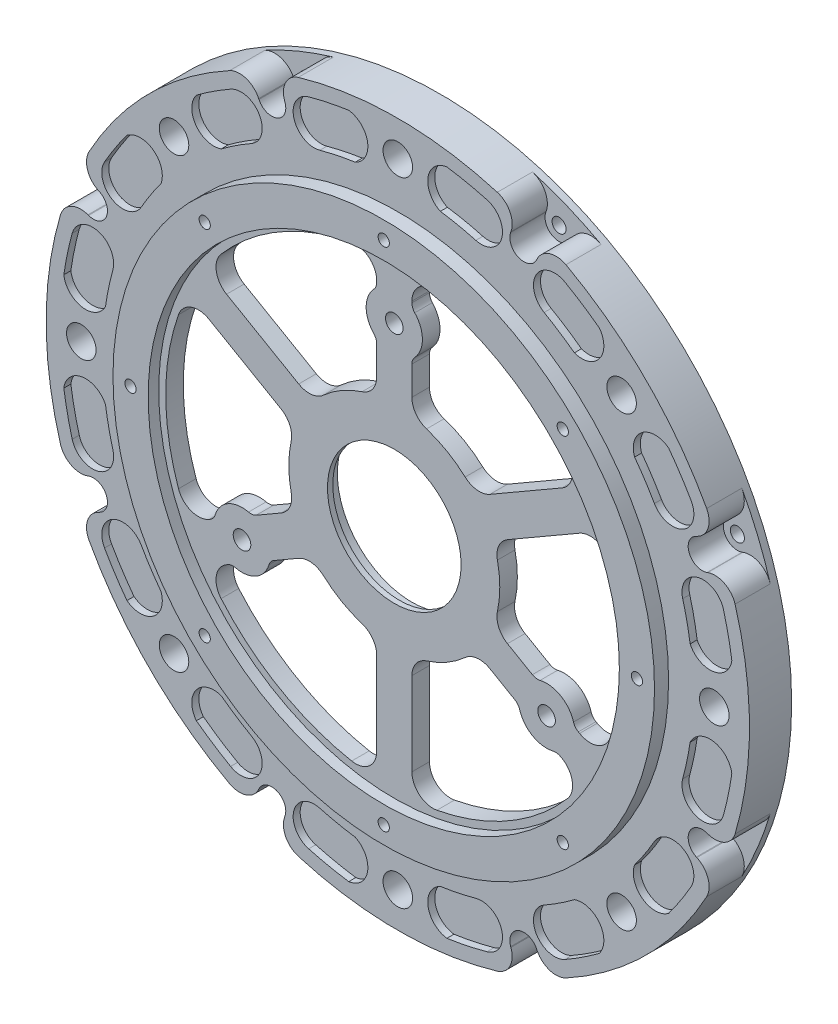
from build123d import *

# Parameters (mm, degrees)
SKETCH1_R                = 50
SKETCH1_R_2              = 10.6
BOSS_EXTRUDE1_DEPTH      = 9
CUT_EXTRUDE2_DEPTH       = 5
SKETCH3_R                = 50
SKETCH3_R_2              = 48.4
CUT_EXTRUDE3_DEPTH       = 1
CUT_EXTRUDE4_START       = 9
CUT_EXTRUDE4_DEPTH       = 3
CUT_EXTRUDE5_START       = 7
SKETCH6_R                = 50
SKETCH6_R_2              = 38.5
CUT_EXTRUDE5_DEPTH       = 2
CUT_EXTRUDE6_START       = 9
SKETCH5_R                = 33.5
CUT_EXTRUDE6_DEPTH       = 1.5
CUT_EXTRUDE9_START       = 7
SKETCH22_R               = 1
CUT_EXTRUDE9_DEPTH       = 79.281133549
CUT_EXTRUDE10_DEPTH      = 72.281133549
CUT_EXTRUDE10_DEPTH_BACK = 5
CUT_EXTRUDE10_START      = 7
BOSS_EXTRUDE3_START      = 7.5
SKETCH26_R               = 10.75
SKETCH26_R_2             = 9.5
BOSS_EXTRUDE3_DEPTH      = 0.75
M3_TAPPED_HOLE2_D        = 2.5
M5_TAPPED_HOLE1_D        = 4.2
M2_TAPPED_HOLE1_D        = 1.6


with BuildPart() as part:
    # Sketch1 → Boss-Extrude1 (new body)
    with BuildSketch(Plane.XY):
        Circle(SKETCH1_R)
        Circle(SKETCH1_R_2, mode=Mode.SUBTRACT)
        with BuildLine():
            Line((26.349800796, 12.326313237), (16.092927609, 6.404504741))
            ThreePointArc((16.092927609, 6.404504741), (14.850076555, 5.021652006), (14.660773007, 3.172023775))
            ThreePointArc((14.660773007, 3.172023775), (15, 0), (14.660773007, -3.172023775))
            ThreePointArc((14.660773007, -3.172023775), (14.850076555, -5.021652006), (16.092927609, -6.404504741))
            Line((16.092927609, -6.404504741), (19.631460887, -8.447477882))
            ThreePointArc((19.631460887, -8.447477882), (20.164172216, -8.632618213), (20.727599307, -8.607956201))
            ThreePointArc((20.727599307, -8.607956201), (23.650635095, -9.035898385), (25.482761791, -11.353350541))
            ThreePointArc((25.482761791, -11.353350541), (25.743117408, -11.853623721), (26.169809302, -12.222395099))
            Line((26.169809302, -12.222395099), (26.349800796, -12.326313237))
            ThreePointArc((26.349800796, -12.326313237), (28.894170631, -12.540583314), (30.681983928, -10.717549265))
            ThreePointArc((30.681983928, -10.717549265), (32.5, 0), (30.681983928, 10.717549265))
            ThreePointArc((30.681983928, 10.717549265), (28.894170631, 12.540583314), (26.349800796, 12.326313237))
        make_face(mode=Mode.SUBTRACT)
        with BuildLine():
            Line((23.849800796, 16.656440256), (13.592927609, 10.73463176))
            ThreePointArc((13.592927609, 10.73463176), (11.773916484, 10.349717542), (10.077439674, 11.110589976))
            ThreePointArc((10.077439674, 11.110589976), (7.5, 12.990381057), (4.583333333, 14.282613751))
            ThreePointArc((4.583333333, 14.282613751), (3.076160071, 15.371369548), (2.5, 17.139136501))
            Line((2.5, 17.139136501), (2.5, 21.225082782))
            ThreePointArc((2.5, 21.225082782), (2.606019434, 21.778994492), (2.909090909, 22.25460566))
            ThreePointArc((2.909090909, 22.25460566), (4, 25), (2.909090909, 27.74539434))
            ThreePointArc((2.909090909, 27.74539434), (2.606019434, 28.221005508), (2.5, 28.774917218))
            Line((2.5, 28.774917218), (2.5, 28.982753492))
            ThreePointArc((2.5, 28.982753492), (3.586621588, 31.293377445), (6.059322034, 31.930152153))
            ThreePointArc((6.059322034, 31.930152153), (16.25, 28.145825623), (24.622661894, 21.212602887))
            ThreePointArc((24.622661894, 21.212602887), (25.307549044, 18.752794131), (23.849800796, 16.656440256))
        make_face(mode=Mode.SUBTRACT)
        with BuildLine():
            Line((-2.5, 28.982753492), (-2.5, 28.774917218))
            ThreePointArc((-2.5, 28.774917218), (-2.606019434, 28.221005508), (-2.909090909, 27.74539434))
            ThreePointArc((-2.909090909, 27.74539434), (-4, 25), (-2.909090909, 22.25460566))
            ThreePointArc((-2.909090909, 22.25460566), (-2.606019434, 21.778994492), (-2.5, 21.225082782))
            Line((-2.5, 21.225082782), (-2.5, 17.139136501))
            ThreePointArc((-2.5, 17.139136501), (-3.076160071, 15.371369548), (-4.583333333, 14.282613751))
            ThreePointArc((-4.583333333, 14.282613751), (-7.5, 12.990381057), (-10.077439674, 11.110589976))
            ThreePointArc((-10.077439674, 11.110589976), (-11.773916484, 10.349717542), (-13.592927609, 10.73463176))
            Line((-13.592927609, 10.73463176), (-23.849800796, 16.656440256))
            ThreePointArc((-23.849800796, 16.656440256), (-25.307549044, 18.752794131), (-24.622661894, 21.212602887))
            ThreePointArc((-24.622661894, 21.212602887), (-16.25, 28.145825623), (-6.059322034, 31.930152153))
            ThreePointArc((-6.059322034, 31.930152153), (-3.586621588, 31.293377445), (-2.5, 28.982753492))
        make_face(mode=Mode.SUBTRACT)
        with BuildLine():
            Line((23.849800796, -16.656440256), (23.669809302, -16.552522118))
            ThreePointArc((23.669809302, -16.552522118), (23.137097973, -16.367381787), (22.573670882, -16.392043799))
            ThreePointArc((22.573670882, -16.392043799), (19.650635095, -15.964101615), (17.818508398, -13.646649459))
            ThreePointArc((17.818508398, -13.646649459), (17.558152782, -13.146376279), (17.131460887, -12.777604901))
            Line((17.131460887, -12.777604901), (13.592927609, -10.73463176))
            ThreePointArc((13.592927609, -10.73463176), (11.773916484, -10.349717542), (10.077439674, -11.110589976))
            ThreePointArc((10.077439674, -11.110589976), (7.5, -12.990381057), (4.583333333, -14.282613751))
            ThreePointArc((4.583333333, -14.282613751), (3.076160071, -15.371369548), (2.5, -17.139136501))
            Line((2.5, -17.139136501), (2.5, -28.982753492))
            ThreePointArc((2.5, -28.982753492), (3.586621588, -31.293377445), (6.059322034, -31.930152153))
            ThreePointArc((6.059322034, -31.930152153), (16.25, -28.145825623), (24.622661894, -21.212602887))
            ThreePointArc((24.622661894, -21.212602887), (25.307549044, -18.752794131), (23.849800796, -16.656440256))
        make_face(mode=Mode.SUBTRACT)
        with BuildLine():
            Line((-2.5, -28.982753492), (-2.5, -17.139136501))
            ThreePointArc((-2.5, -17.139136501), (-3.076160071, -15.371369548), (-4.583333333, -14.282613751))
            ThreePointArc((-4.583333333, -14.282613751), (-7.5, -12.990381057), (-10.077439674, -11.110589976))
            ThreePointArc((-10.077439674, -11.110589976), (-11.773916484, -10.349717542), (-13.592927609, -10.73463176))
            Line((-13.592927609, -10.73463176), (-17.131460887, -12.777604901))
            ThreePointArc((-17.131460887, -12.777604901), (-17.558152782, -13.146376279), (-17.818508398, -13.646649459))
            ThreePointArc((-17.818508398, -13.646649459), (-19.650635095, -15.964101615), (-22.573670882, -16.392043799))
            ThreePointArc((-22.573670882, -16.392043799), (-23.137097973, -16.367381787), (-23.669809302, -16.552522118))
            Line((-23.669809302, -16.552522118), (-23.849800796, -16.656440256))
            ThreePointArc((-23.849800796, -16.656440256), (-25.307549044, -18.752794131), (-24.622661894, -21.212602887))
            ThreePointArc((-24.622661894, -21.212602887), (-16.25, -28.145825623), (-6.059322034, -31.930152153))
            ThreePointArc((-6.059322034, -31.930152153), (-3.586621588, -31.293377445), (-2.5, -28.982753492))
        make_face(mode=Mode.SUBTRACT)
        with BuildLine():
            Line((-26.349800796, -12.326313237), (-26.169809302, -12.222395099))
            ThreePointArc((-26.169809302, -12.222395099), (-25.743117408, -11.853623721), (-25.482761791, -11.353350541))
            ThreePointArc((-25.482761791, -11.353350541), (-23.650635095, -9.035898385), (-20.727599307, -8.607956201))
            ThreePointArc((-20.727599307, -8.607956201), (-20.164172216, -8.632618213), (-19.631460887, -8.447477882))
            Line((-19.631460887, -8.447477882), (-16.092927609, -6.404504741))
            ThreePointArc((-16.092927609, -6.404504741), (-14.850076555, -5.021652006), (-14.660773007, -3.172023775))
            ThreePointArc((-14.660773007, -3.172023775), (-15, 0), (-14.660773007, 3.172023775))
            ThreePointArc((-14.660773007, 3.172023775), (-14.850076555, 5.021652006), (-16.092927609, 6.404504741))
            Line((-16.092927609, 6.404504741), (-26.349800796, 12.326313237))
            ThreePointArc((-26.349800796, 12.326313237), (-28.894170631, 12.540583314), (-30.681983928, 10.717549265))
            ThreePointArc((-30.681983928, 10.717549265), (-32.5, 0), (-30.681983928, -10.717549265))
            ThreePointArc((-30.681983928, -10.717549265), (-28.894170631, -12.540583314), (-26.349800796, -12.326313237))
        make_face(mode=Mode.SUBTRACT)
    extrude(amount=BOSS_EXTRUDE1_DEPTH)

    # Sketch2 → Cut-Extrude2 (cut)
    with BuildSketch(Plane.XY):
        with BuildLine():
            Line((-3.897114317, 42.75), (-5.004320592, 44.667737523))
            ThreePointArc((-5.004320592, 44.667737523), (-6.81682528, 46.310844382), (-9.247127698, 46.59120764))
            ThreePointArc((-9.247127698, 46.59120764), (-11.055694985, 46.195471731), (-12.847467305, 45.729559192))
            ThreePointArc((-12.847467305, 45.729559192), (-14.303478701, 44.80574904), (-15.010382901, 43.232955082))
            Line((-15.010382901, 43.232955082), (-15.053528708, 42.905230141))
            ThreePointArc((-15.053528708, 42.905230141), (-16.818936852, 40.604505454), (-19.69412695, 40.983031411))
            Line((-19.69412695, 40.983031411), (-19.956372172, 41.184259247))
            ThreePointArc((-19.956372172, 41.184259247), (-21.568362198, 41.796535767), (-23.251150153, 41.420212657))
            ThreePointArc((-23.251150153, 41.420212657), (-24.847574426, 40.482688215), (-26.406252164, 39.483665567))
            ThreePointArc((-26.406252164, 39.483665567), (-27.926488724, 37.566935487), (-28.046271077, 35.123449129))
            Line((-28.046271077, 35.123449129), (-27.473138935, 32.984490856))
            ThreePointArc((-27.473138935, 32.984490856), (-28.637824638, 28.637824638), (-32.984490856, 27.473138935))
            Line((-32.984490856, 27.473138935), (-35.123449129, 28.046271077))
            ThreePointArc((-35.123449129, 28.046271077), (-37.566935487, 27.926488724), (-39.483665567, 26.406252164))
            ThreePointArc((-39.483665567, 26.406252164), (-40.482688215, 24.847574426), (-41.420212657, 23.251150153))
            ThreePointArc((-41.420212657, 23.251150153), (-41.796535767, 21.568362198), (-41.184259247, 19.956372172))
            Line((-41.184259247, 19.956372172), (-40.983031411, 19.69412695))
            ThreePointArc((-40.983031411, 19.69412695), (-40.604505454, 16.818936852), (-42.905230141, 15.053528708))
            Line((-42.905230141, 15.053528708), (-43.232955082, 15.010382901))
            ThreePointArc((-43.232955082, 15.010382901), (-44.80574904, 14.303478701), (-45.729559192, 12.847467305))
            ThreePointArc((-45.729559192, 12.847467305), (-46.195471731, 11.055694985), (-46.59120764, 9.247127698))
            ThreePointArc((-46.59120764, 9.247127698), (-46.310844382, 6.81682528), (-44.667737523, 5.004320592))
            Line((-44.667737523, 5.004320592), (-42.75, 3.897114317))
            ThreePointArc((-42.75, 3.897114317), (-40.5, 0), (-42.75, -3.897114317))
            Line((-42.75, -3.897114317), (-44.667737523, -5.004320592))
            ThreePointArc((-44.667737523, -5.004320592), (-46.310844382, -6.81682528), (-46.59120764, -9.247127698))
            ThreePointArc((-46.59120764, -9.247127698), (-46.195471731, -11.055694985), (-45.729559192, -12.847467305))
            ThreePointArc((-45.729559192, -12.847467305), (-44.80574904, -14.303478701), (-43.232955082, -15.010382901))
            Line((-43.232955082, -15.010382901), (-42.905230141, -15.053528708))
            ThreePointArc((-42.905230141, -15.053528708), (-40.604505454, -16.818936852), (-40.983031411, -19.69412695))
            Line((-40.983031411, -19.69412695), (-41.184259247, -19.956372172))
            ThreePointArc((-41.184259247, -19.956372172), (-41.796535767, -21.568362198), (-41.420212657, -23.251150153))
            ThreePointArc((-41.420212657, -23.251150153), (-40.482688215, -24.847574426), (-39.483665567, -26.406252164))
            ThreePointArc((-39.483665567, -26.406252164), (-37.566935487, -27.926488724), (-35.123449129, -28.046271077))
            Line((-35.123449129, -28.046271077), (-32.984490856, -27.473138935))
            ThreePointArc((-32.984490856, -27.473138935), (-28.637824638, -28.637824638), (-27.473138935, -32.984490856))
            Line((-27.473138935, -32.984490856), (-28.046271077, -35.123449129))
            ThreePointArc((-28.046271077, -35.123449129), (-27.926488724, -37.566935487), (-26.406252164, -39.483665567))
            ThreePointArc((-26.406252164, -39.483665567), (-24.847574426, -40.482688215), (-23.251150153, -41.420212657))
            ThreePointArc((-23.251150153, -41.420212657), (-21.568362198, -41.796535767), (-19.956372172, -41.184259247))
            Line((-19.956372172, -41.184259247), (-19.69412695, -40.983031411))
            ThreePointArc((-19.69412695, -40.983031411), (-16.818936852, -40.604505454), (-15.053528708, -42.905230141))
            Line((-15.053528708, -42.905230141), (-15.010382901, -43.232955082))
            ThreePointArc((-15.010382901, -43.232955082), (-14.303478701, -44.80574904), (-12.847467305, -45.729559192))
            ThreePointArc((-12.847467305, -45.729559192), (-11.055694985, -46.195471731), (-9.247127698, -46.59120764))
            ThreePointArc((-9.247127698, -46.59120764), (-6.81682528, -46.310844382), (-5.004320592, -44.667737523))
            Line((-5.004320592, -44.667737523), (-3.897114317, -42.75))
            ThreePointArc((-3.897114317, -42.75), (0, -40.5), (3.897114317, -42.75))
            Line((3.897114317, -42.75), (5.004320592, -44.667737523))
            ThreePointArc((5.004320592, -44.667737523), (6.81682528, -46.310844382), (9.247127698, -46.59120764))
            ThreePointArc((9.247127698, -46.59120764), (11.055694985, -46.195471731), (12.847467305, -45.729559192))
            ThreePointArc((12.847467305, -45.729559192), (14.303478701, -44.80574904), (15.010382901, -43.232955082))
            Line((15.010382901, -43.232955082), (15.053528708, -42.905230141))
            ThreePointArc((15.053528708, -42.905230141), (16.818936852, -40.604505454), (19.69412695, -40.983031411))
            Line((19.69412695, -40.983031411), (19.956372172, -41.184259247))
            ThreePointArc((19.956372172, -41.184259247), (21.568362198, -41.796535767), (23.251150153, -41.420212657))
            ThreePointArc((23.251150153, -41.420212657), (24.847574426, -40.482688215), (26.406252164, -39.483665567))
            ThreePointArc((26.406252164, -39.483665567), (27.926488724, -37.566935487), (28.046271077, -35.123449129))
            Line((28.046271077, -35.123449129), (27.473138935, -32.984490856))
            ThreePointArc((27.473138935, -32.984490856), (28.637824638, -28.637824638), (32.984490856, -27.473138935))
            Line((32.984490856, -27.473138935), (35.123449129, -28.046271077))
            ThreePointArc((35.123449129, -28.046271077), (37.566935487, -27.926488724), (39.483665567, -26.406252164))
            ThreePointArc((39.483665567, -26.406252164), (40.482688215, -24.847574426), (41.420212657, -23.251150153))
            ThreePointArc((41.420212657, -23.251150153), (41.796535767, -21.568362198), (41.184259247, -19.956372172))
            Line((41.184259247, -19.956372172), (40.983031411, -19.69412695))
            ThreePointArc((40.983031411, -19.69412695), (40.604505454, -16.818936852), (42.905230141, -15.053528708))
            Line((42.905230141, -15.053528708), (43.232955082, -15.010382901))
            ThreePointArc((43.232955082, -15.010382901), (44.80574904, -14.303478701), (45.729559192, -12.847467305))
            ThreePointArc((45.729559192, -12.847467305), (46.195471731, -11.055694985), (46.59120764, -9.247127698))
            ThreePointArc((46.59120764, -9.247127698), (46.310844382, -6.81682528), (44.667737523, -5.004320592))
            Line((44.667737523, -5.004320592), (42.75, -3.897114317))
            ThreePointArc((42.75, -3.897114317), (40.5, 0), (42.75, 3.897114317))
            Line((42.75, 3.897114317), (44.667737523, 5.004320592))
            ThreePointArc((44.667737523, 5.004320592), (46.310844382, 6.81682528), (46.59120764, 9.247127698))
            ThreePointArc((46.59120764, 9.247127698), (46.195471731, 11.055694985), (45.729559192, 12.847467305))
            ThreePointArc((45.729559192, 12.847467305), (44.80574904, 14.303478701), (43.232955082, 15.010382901))
            Line((43.232955082, 15.010382901), (42.905230141, 15.053528708))
            ThreePointArc((42.905230141, 15.053528708), (40.604505454, 16.818936852), (40.983031411, 19.69412695))
            Line((40.983031411, 19.69412695), (41.184259247, 19.956372172))
            ThreePointArc((41.184259247, 19.956372172), (41.796535767, 21.568362198), (41.420212657, 23.251150153))
            ThreePointArc((41.420212657, 23.251150153), (40.482688215, 24.847574426), (39.483665567, 26.406252164))
            ThreePointArc((39.483665567, 26.406252164), (37.566935487, 27.926488724), (35.123449129, 28.046271077))
            Line((35.123449129, 28.046271077), (32.984490856, 27.473138935))
            ThreePointArc((32.984490856, 27.473138935), (28.637824638, 28.637824638), (27.473138935, 32.984490856))
            Line((27.473138935, 32.984490856), (28.046271077, 35.123449129))
            ThreePointArc((28.046271077, 35.123449129), (27.926488724, 37.566935487), (26.406252164, 39.483665567))
            ThreePointArc((26.406252164, 39.483665567), (24.847574426, 40.482688215), (23.251150153, 41.420212657))
            ThreePointArc((23.251150153, 41.420212657), (21.568362198, 41.796535767), (19.956372172, 41.184259247))
            Line((19.956372172, 41.184259247), (19.69412695, 40.983031411))
            ThreePointArc((19.69412695, 40.983031411), (16.818936852, 40.604505454), (15.053528708, 42.905230141))
            Line((15.053528708, 42.905230141), (15.010382901, 43.232955082))
            ThreePointArc((15.010382901, 43.232955082), (14.303478701, 44.80574904), (12.847467305, 45.729559192))
            ThreePointArc((12.847467305, 45.729559192), (11.055694985, 46.195471731), (9.247127698, 46.59120764))
            ThreePointArc((9.247127698, 46.59120764), (6.81682528, 46.310844382), (5.004320592, 44.667737523))
            Line((5.004320592, 44.667737523), (3.897114317, 42.75))
            ThreePointArc((3.897114317, 42.75), (0, 40.5), (-3.897114317, 42.75))
        make_face()
    extrude(amount=CUT_EXTRUDE2_DEPTH, mode=Mode.SUBTRACT)

    # Sketch3 → Cut-Extrude3 (cut)
    with BuildSketch(Plane.XY):
        Circle(SKETCH3_R)
        Circle(SKETCH3_R_2, mode=Mode.SUBTRACT)
    extrude(amount=CUT_EXTRUDE3_DEPTH, mode=Mode.SUBTRACT)

    # Sketch4 → Cut-Extrude4 (cut)
    with BuildSketch(Plane.XY.offset(CUT_EXTRUDE4_START)):
        with BuildLine():
            ThreePointArc((-12.675532655, 46.296121564), (-14.776819462, 42.610393176), (-11.091091074, 40.509106369))
            ThreePointArc((-11.091091074, 40.509106369), (-8.587247433, 41.112761784), (-6.051110909, 41.561810076))
            ThreePointArc((-6.051110909, 41.561810076), (-4.294414414, 44.872928203), (-6.977647817, 47.490129827))
            ThreePointArc((-6.977647817, 47.490129827), (-9.844708711, 46.979588231), (-12.675532655, 46.296121564))
        make_face()
        with BuildLine():
            ThreePointArc((6.051110909, 41.561810076), (8.587247433, 41.112761784), (11.091091074, 40.509106369))
            ThreePointArc((11.091091074, 40.509106369), (14.776819462, 42.610393176), (12.675532655, 46.296121564))
            ThreePointArc((12.675532655, 46.296121564), (9.844708711, 46.979588231), (6.977647817, 47.490129827))
            ThreePointArc((6.977647817, 47.490129827), (4.294414414, 44.872928203), (6.051110909, 41.561810076))
        make_face()
        with BuildLine():
            ThreePointArc((25.109856186, 33.6674193), (22.999011759, 35.143213542), (20.801678104, 36.486849522))
            ThreePointArc((20.801678104, 36.486849522), (19.681308717, 40.57888721), (23.773346405, 41.699256597))
            ThreePointArc((23.773346405, 41.699256597), (26.258325128, 40.180845704), (28.646650752, 38.514534928))
            ThreePointArc((28.646650752, 38.514534928), (28.693342271, 34.766561378), (25.109856186, 33.6674193))
        make_face()
        with BuildLine():
            ThreePointArc((33.6674193, 25.109856186), (35.143213542, 22.999011759), (36.486849522, 20.801678104))
            ThreePointArc((36.486849522, 20.801678104), (40.57888721, 19.681308717), (41.699256597, 23.773346405))
            ThreePointArc((41.699256597, 23.773346405), (40.180845704, 26.258325128), (38.514534928, 28.646650752))
            ThreePointArc((38.514534928, 28.646650752), (34.766561378, 28.693342271), (33.6674193, 25.109856186))
        make_face()
        with BuildLine():
            ThreePointArc((41.561810076, 6.051110909), (41.112761784, 8.587247433), (40.509106369, 11.091091074))
            ThreePointArc((40.509106369, 11.091091074), (42.610393176, 14.776819462), (46.296121564, 12.675532655))
            ThreePointArc((46.296121564, 12.675532655), (46.979588231, 9.844708711), (47.490129827, 6.977647817))
            ThreePointArc((47.490129827, 6.977647817), (44.872928203, 4.294414414), (41.561810076, 6.051110909))
        make_face()
        with BuildLine():
            ThreePointArc((41.561810076, -6.051110909), (41.112761784, -8.587247433), (40.509106369, -11.091091074))
            ThreePointArc((40.509106369, -11.091091074), (42.610393176, -14.776819462), (46.296121564, -12.675532655))
            ThreePointArc((46.296121564, -12.675532655), (46.979588231, -9.844708711), (47.490129827, -6.977647817))
            ThreePointArc((47.490129827, -6.977647817), (44.872928203, -4.294414414), (41.561810076, -6.051110909))
        make_face()
        with BuildLine():
            ThreePointArc((33.6674193, -25.109856186), (35.143213542, -22.999011759), (36.486849522, -20.801678104))
            ThreePointArc((36.486849522, -20.801678104), (40.57888721, -19.681308717), (41.699256597, -23.773346405))
            ThreePointArc((41.699256597, -23.773346405), (40.180845704, -26.258325128), (38.514534928, -28.646650752))
            ThreePointArc((38.514534928, -28.646650752), (34.766561378, -28.693342271), (33.6674193, -25.109856186))
        make_face()
        with BuildLine():
            ThreePointArc((25.109856186, -33.6674193), (22.999011759, -35.143213542), (20.801678104, -36.486849522))
            ThreePointArc((20.801678104, -36.486849522), (19.681308717, -40.57888721), (23.773346405, -41.699256597))
            ThreePointArc((23.773346405, -41.699256597), (26.258325128, -40.180845704), (28.646650752, -38.514534928))
            ThreePointArc((28.646650752, -38.514534928), (28.693342271, -34.766561378), (25.109856186, -33.6674193))
        make_face()
        with BuildLine():
            ThreePointArc((6.051110909, -41.561810076), (8.587247433, -41.112761784), (11.091091074, -40.509106369))
            ThreePointArc((11.091091074, -40.509106369), (14.776819462, -42.610393176), (12.675532655, -46.296121564))
            ThreePointArc((12.675532655, -46.296121564), (9.844708711, -46.979588231), (6.977647817, -47.490129827))
            ThreePointArc((6.977647817, -47.490129827), (4.294414414, -44.872928203), (6.051110909, -41.561810076))
        make_face()
        with BuildLine():
            ThreePointArc((-6.051110909, -41.561810076), (-8.587247433, -41.112761784), (-11.091091074, -40.509106369))
            ThreePointArc((-11.091091074, -40.509106369), (-14.776819462, -42.610393176), (-12.675532655, -46.296121564))
            ThreePointArc((-12.675532655, -46.296121564), (-9.844708711, -46.979588231), (-6.977647817, -47.490129827))
            ThreePointArc((-6.977647817, -47.490129827), (-4.294414414, -44.872928203), (-6.051110909, -41.561810076))
        make_face()
        with BuildLine():
            ThreePointArc((-25.109856186, -33.6674193), (-22.999011759, -35.143213542), (-20.801678104, -36.486849522))
            ThreePointArc((-20.801678104, -36.486849522), (-19.681308717, -40.57888721), (-23.773346405, -41.699256597))
            ThreePointArc((-23.773346405, -41.699256597), (-26.258325128, -40.180845704), (-28.646650752, -38.514534928))
            ThreePointArc((-28.646650752, -38.514534928), (-28.693342271, -34.766561378), (-25.109856186, -33.6674193))
        make_face()
        with BuildLine():
            ThreePointArc((-33.6674193, -25.109856186), (-35.143213542, -22.999011759), (-36.486849522, -20.801678104))
            ThreePointArc((-36.486849522, -20.801678104), (-40.57888721, -19.681308717), (-41.699256597, -23.773346405))
            ThreePointArc((-41.699256597, -23.773346405), (-40.180845704, -26.258325128), (-38.514534928, -28.646650752))
            ThreePointArc((-38.514534928, -28.646650752), (-34.766561378, -28.693342271), (-33.6674193, -25.109856186))
        make_face()
        with BuildLine():
            ThreePointArc((-41.561810076, -6.051110909), (-41.112761784, -8.587247433), (-40.509106369, -11.091091074))
            ThreePointArc((-40.509106369, -11.091091074), (-42.610393176, -14.776819462), (-46.296121564, -12.675532655))
            ThreePointArc((-46.296121564, -12.675532655), (-46.979588231, -9.844708711), (-47.490129827, -6.977647817))
            ThreePointArc((-47.490129827, -6.977647817), (-44.872928203, -4.294414414), (-41.561810076, -6.051110909))
        make_face()
        with BuildLine():
            ThreePointArc((-41.561810076, 6.051110909), (-41.112761784, 8.587247433), (-40.509106369, 11.091091074))
            ThreePointArc((-40.509106369, 11.091091074), (-42.610393176, 14.776819462), (-46.296121564, 12.675532655))
            ThreePointArc((-46.296121564, 12.675532655), (-46.979588231, 9.844708711), (-47.490129827, 6.977647817))
            ThreePointArc((-47.490129827, 6.977647817), (-44.872928203, 4.294414414), (-41.561810076, 6.051110909))
        make_face()
        with BuildLine():
            ThreePointArc((-33.6674193, 25.109856186), (-35.143213542, 22.999011759), (-36.486849522, 20.801678104))
            ThreePointArc((-36.486849522, 20.801678104), (-40.57888721, 19.681308717), (-41.699256597, 23.773346405))
            ThreePointArc((-41.699256597, 23.773346405), (-40.180845704, 26.258325128), (-38.514534928, 28.646650752))
            ThreePointArc((-38.514534928, 28.646650752), (-34.766561378, 28.693342271), (-33.6674193, 25.109856186))
        make_face()
        with BuildLine():
            ThreePointArc((-25.109856186, 33.6674193), (-22.999011759, 35.143213542), (-20.801678104, 36.486849522))
            ThreePointArc((-20.801678104, 36.486849522), (-19.681308717, 40.57888721), (-23.773346405, 41.699256597))
            ThreePointArc((-23.773346405, 41.699256597), (-26.258325128, 40.180845704), (-28.646650752, 38.514534928))
            ThreePointArc((-28.646650752, 38.514534928), (-28.693342271, 34.766561378), (-25.109856186, 33.6674193))
        make_face()
    extrude(amount=-CUT_EXTRUDE4_DEPTH, mode=Mode.SUBTRACT)

    # Sketch6 → Cut-Extrude5 (cut)
    with BuildSketch(Plane.XY.offset(CUT_EXTRUDE5_START)):
        Circle(SKETCH6_R)
        Circle(SKETCH6_R_2, mode=Mode.SUBTRACT)
    extrude(amount=CUT_EXTRUDE5_DEPTH, mode=Mode.SUBTRACT)

    # Sketch5 → Cut-Extrude6 (cut)
    with BuildSketch(Plane.XY.offset(CUT_EXTRUDE6_START)):
        Circle(SKETCH5_R)
    extrude(amount=-CUT_EXTRUDE6_DEPTH, mode=Mode.SUBTRACT)

    # Sketch22 → Cut-Extrude9 (cut, through all)
    with BuildSketch(Plane.XY.offset(CUT_EXTRUDE9_START)):
        with Locations((-17.928718806, 43.283756098)):
            Circle(SKETCH22_R)
        with Locations((17.928718806, 43.283756098)):
            Circle(SKETCH22_R)
        with Locations((43.283756098, 17.928718806)):
            Circle(SKETCH22_R)
        with Locations((43.283756098, -17.928718806)):
            Circle(SKETCH22_R)
        with Locations((17.928718806, -43.283756098)):
            Circle(SKETCH22_R)
        with Locations((-17.928718806, -43.283756098)):
            Circle(SKETCH22_R)
        with Locations((-43.283756098, -17.928718806)):
            Circle(SKETCH22_R)
        with Locations((-43.283756098, 17.928718806)):
            Circle(SKETCH22_R)
    extrude(amount=-CUT_EXTRUDE9_DEPTH, mode=Mode.SUBTRACT)

    # Sketch23 → Cut-Extrude10 (cut, two sides: drawn at the far end of the back side and taken through both)
    with BuildSketch(Plane.XY.offset(CUT_EXTRUDE10_START - CUT_EXTRUDE10_DEPTH_BACK)):
        with BuildLine():
            Line((-19.782052709, 42.526219206), (-19.742756406, 42.44157584))
            ThreePointArc((-19.742756406, 42.44157584), (-17.163351942, 41.435997033), (-16.050489147, 43.970963015))
            Line((-16.050489147, 43.970963015), (-16.082554362, 44.058601595))
            ThreePointArc((-16.082554362, 44.058601595), (-15.952452511, 46.423101216), (-14.147964124, 47.956596117))
            ThreePointArc((-14.147964124, 47.956596117), (-19.134171618, 46.193976626), (-23.906312945, 43.914555689))
            ThreePointArc((-23.906312945, 43.914555689), (-21.546002327, 44.106177021), (-19.782052709, 42.526219206))
        make_face()
        with BuildLine():
            Line((16.082554362, 44.058601595), (16.050489147, 43.970963015))
            ThreePointArc((16.050489147, 43.970963015), (17.163351942, 41.435997033), (19.742756406, 42.44157584))
            Line((19.742756406, 42.44157584), (19.782052709, 42.526219206))
            ThreePointArc((19.782052709, 42.526219206), (21.546002327, 44.106177021), (23.906312945, 43.914555689))
            ThreePointArc((23.906312945, 43.914555689), (19.134171618, 46.193976626), (14.147964124, 47.956596117))
            ThreePointArc((14.147964124, 47.956596117), (15.952452511, 46.423101216), (16.082554362, 44.058601595))
        make_face()
        with BuildLine():
            Line((42.526219206, 19.782052709), (42.44157584, 19.742756406))
            ThreePointArc((42.44157584, 19.742756406), (41.435997033, 17.163351942), (43.970963015, 16.050489147))
            Line((43.970963015, 16.050489147), (44.058601595, 16.082554362))
            ThreePointArc((44.058601595, 16.082554362), (46.423101216, 15.952452511), (47.956596117, 14.147964124))
            ThreePointArc((47.956596117, 14.147964124), (46.193976626, 19.134171618), (43.914555689, 23.906312945))
            ThreePointArc((43.914555689, 23.906312945), (44.106177021, 21.546002327), (42.526219206, 19.782052709))
        make_face()
        with BuildLine():
            Line((44.058601595, -16.082554362), (43.970963015, -16.050489147))
            ThreePointArc((43.970963015, -16.050489147), (41.435997033, -17.163351942), (42.44157584, -19.742756406))
            Line((42.44157584, -19.742756406), (42.526219206, -19.782052709))
            ThreePointArc((42.526219206, -19.782052709), (44.106177021, -21.546002327), (43.914555689, -23.906312945))
            ThreePointArc((43.914555689, -23.906312945), (46.193976626, -19.134171618), (47.956596117, -14.147964124))
            ThreePointArc((47.956596117, -14.147964124), (46.423101216, -15.952452511), (44.058601595, -16.082554362))
        make_face()
        with BuildLine():
            Line((19.782052709, -42.526219206), (19.742756406, -42.44157584))
            ThreePointArc((19.742756406, -42.44157584), (17.163351942, -41.435997033), (16.050489147, -43.970963015))
            Line((16.050489147, -43.970963015), (16.082554362, -44.058601595))
            ThreePointArc((16.082554362, -44.058601595), (15.952452511, -46.423101216), (14.147964124, -47.956596117))
            ThreePointArc((14.147964124, -47.956596117), (19.134171618, -46.193976626), (23.906312945, -43.914555689))
            ThreePointArc((23.906312945, -43.914555689), (21.546002327, -44.106177021), (19.782052709, -42.526219206))
        make_face()
        with BuildLine():
            Line((-16.082554362, -44.058601595), (-16.050489147, -43.970963015))
            ThreePointArc((-16.050489147, -43.970963015), (-17.163351942, -41.435997033), (-19.742756406, -42.44157584))
            Line((-19.742756406, -42.44157584), (-19.782052709, -42.526219206))
            ThreePointArc((-19.782052709, -42.526219206), (-21.546002327, -44.106177021), (-23.906312945, -43.914555689))
            ThreePointArc((-23.906312945, -43.914555689), (-19.134171618, -46.193976626), (-14.147964124, -47.956596117))
            ThreePointArc((-14.147964124, -47.956596117), (-15.952452511, -46.423101216), (-16.082554362, -44.058601595))
        make_face()
        with BuildLine():
            Line((-42.526219206, -19.782052709), (-42.44157584, -19.742756406))
            ThreePointArc((-42.44157584, -19.742756406), (-41.435997033, -17.163351942), (-43.970963015, -16.050489147))
            Line((-43.970963015, -16.050489147), (-44.058601595, -16.082554362))
            ThreePointArc((-44.058601595, -16.082554362), (-46.423101216, -15.952452511), (-47.956596117, -14.147964124))
            ThreePointArc((-47.956596117, -14.147964124), (-46.193976626, -19.134171618), (-43.914555689, -23.906312945))
            ThreePointArc((-43.914555689, -23.906312945), (-44.106177021, -21.546002327), (-42.526219206, -19.782052709))
        make_face()
        with BuildLine():
            Line((-44.058601595, 16.082554362), (-43.970963015, 16.050489147))
            ThreePointArc((-43.970963015, 16.050489147), (-41.435997033, 17.163351942), (-42.44157584, 19.742756406))
            Line((-42.44157584, 19.742756406), (-42.526219206, 19.782052709))
            ThreePointArc((-42.526219206, 19.782052709), (-44.106177021, 21.546002327), (-43.914555689, 23.906312945))
            ThreePointArc((-43.914555689, 23.906312945), (-46.193976626, 19.134171618), (-47.956596117, 14.147964124))
            ThreePointArc((-47.956596117, 14.147964124), (-46.423101216, 15.952452511), (-44.058601595, 16.082554362))
        make_face()
    extrude(amount=CUT_EXTRUDE10_DEPTH + CUT_EXTRUDE10_DEPTH_BACK, mode=Mode.SUBTRACT)

    # Sketch26 → Boss-Extrude3 (add)
    with BuildSketch(Plane.XY.offset(BOSS_EXTRUDE3_START)):
        Circle(SKETCH26_R)
        Circle(SKETCH26_R_2, mode=Mode.SUBTRACT)
    extrude(amount=-BOSS_EXTRUDE3_DEPTH)

    # M3 Tapped Hole2 (through all)
    with Locations(Plane.XY.offset(7.5)):
        with Locations((0, 25), (-21.650635095, -12.5), (21.650635095, -12.5)):
            Hole(M3_TAPPED_HOLE2_D / 2)

    # M5 Tapped Hole1 (through all)
    with Locations(Plane.XY.offset(7)):
        with Locations((0, 45), (-31.819805153, 31.819805153), (-45, 0), (-31.819805153, -31.819805153), (0, -45), (31.819805153, -31.819805153), (45, 0), (31.819805153, 31.819805153)):
            Hole(M5_TAPPED_HOLE1_D / 2)

    # M2 Tapped Hole1 (through all)
    with Locations(Plane.XY.offset(9)):
        with Locations((0, 36), (-25.455844123, 25.455844123), (-36, 0), (-25.455844123, -25.455844123), (0, -36), (25.455844123, -25.455844123), (36, 0), (25.455844123, 25.455844123)):
            Hole(M2_TAPPED_HOLE1_D / 2)


solid = part.part
